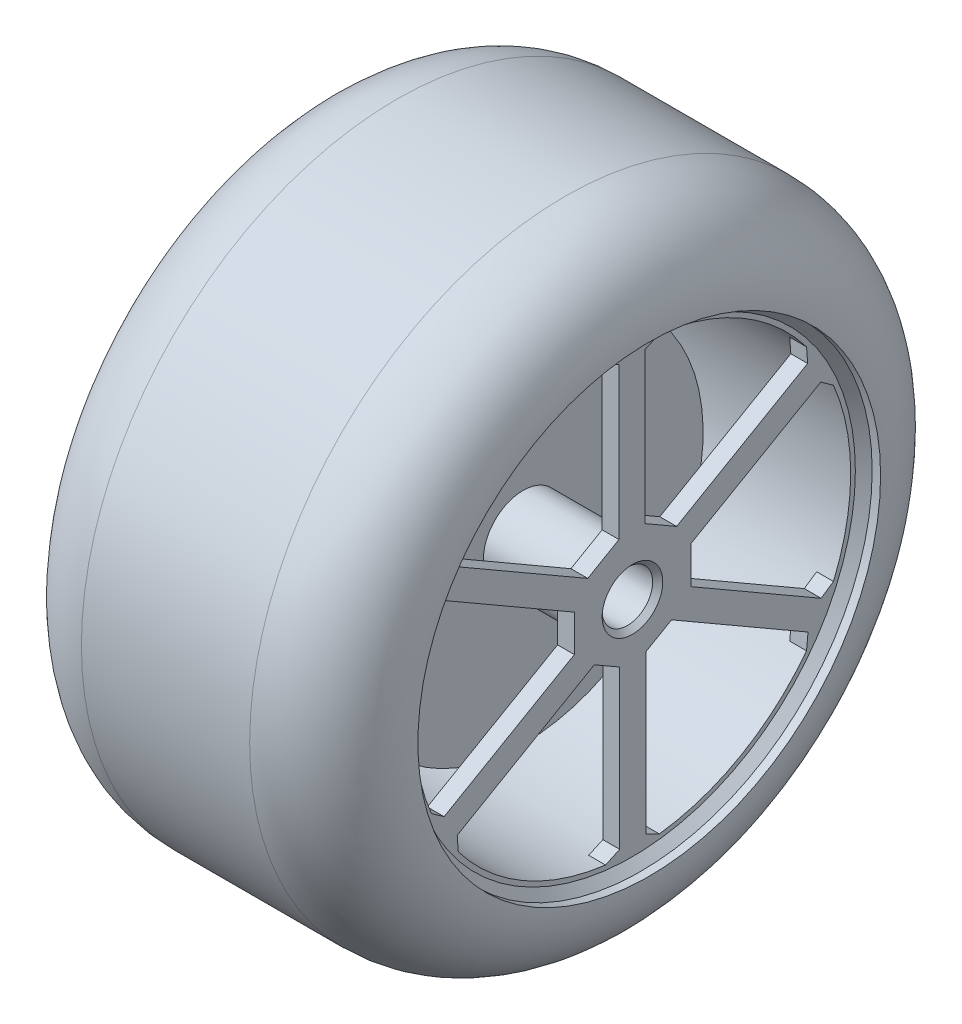
from build123d import *

# Parameters (mm, degrees)
SKETCH1_R            = 18.75
SKETCH1_R_2          = 13.75
BOSS_EXTRUDE1_DEPTH  = 20
FILLET1_R            = 5
BOSS_EXTRUDE2_START  = -19
SKETCH2_R            = 13.75
SKETCH2_R_2          = 12.971945667
BOSS_EXTRUDE2_DEPTH  = 19
CHAMFER2_SIZE        = 0.5
BOSS_EXTRUDE3_DEPTH  = 1
CIRPATTERN1_COUNT    = 6
BOSS_EXTRUDE4_DEPTH  = 1
MIRROR1_COPY_1_DEPTH = 1
MIRROR1_COPY_2_DEPTH = 1
MIRROR1_COPY_3_DEPTH = 1
MIRROR1_COPY_4_DEPTH = 1
MIRROR1_COPY_5_DEPTH = 1
SKETCH7_R            = 10.701124637
BOSS_EXTRUDE5_DEPTH  = 2.5
SKETCH8_R            = 2.357410359
BOSS_EXTRUDE6_DEPTH  = 6
BOSS_EXTRUDE7_DEPTH  = 2
BOSS_EXTRUDE8_START  = 2.5
SKETCH10_R           = 10.701124637
BOSS_EXTRUDE8_DEPTH  = 2.5
SKETCH11_R           = 1.5
CUT_EXTRUDE1_DEPTH   = 4
CHAMFER3_SIZE        = 0.1
CHAMFER4_SIZE        = 0.3


with BuildPart() as part:
    # Sketch1 → Boss-Extrude1 (new body)
    with BuildSketch(Plane(origin=(0, 0, 0), x_dir=(0, 0, -1), z_dir=(1, 0, 0))):
        Circle(SKETCH1_R)
        Circle(SKETCH1_R_2, mode=Mode.SUBTRACT)
    extrude(amount=BOSS_EXTRUDE1_DEPTH)

    # Fillet1
    fillet1_edges = [part.edges().sort_by_distance(p)[0] for p in [
        (0, 0, 18.75),
        (20, 0, 18.75),
    ]]
    fillet(fillet1_edges, radius=FILLET1_R - 0.0001)  # a hair under: the kernel refuses the full size

    # Sketch2 → Boss-Extrude2 (add)
    with BuildSketch(Plane(origin=(19, 0, 0), x_dir=(0, 0, -1), z_dir=(1, 0, 0)).offset(BOSS_EXTRUDE2_START)):
        Circle(SKETCH2_R)
        Circle(SKETCH2_R_2, mode=Mode.SUBTRACT)
    extrude(amount=BOSS_EXTRUDE2_DEPTH)

    # Chamfer2
    chamfer2_edges = [part.edges().sort_by_distance(p)[0] for p in [
        (19, 0, 13.75),
    ]]
    chamfer(chamfer2_edges, length=CHAMFER2_SIZE)

    # Sketch3 → Boss-Extrude3 (add)
    with BuildSketch(Plane(origin=(19, 0, 0), x_dir=(0, 0, -1), z_dir=(1, 0, 0))):
        with BuildLine():
            Line((-0.8, 12.486766378), (-0.8, 2.563983472))
            Line((-0.8, 2.563983472), (0.75747377, 2.563983472))
            Line((0.75747377, 2.563983472), (0.75747377, 12.486766378))
            Line((0.75747377, 12.486766378), (1.6, 12.872893008))
            ThreePointArc((1.6, 12.872893008), (0, 13.015852021), (-1.6, 12.872893008))
            Line((-1.6, 12.872893008), (-0.8, 12.486766378))
        make_face()
    boss_extrude3 = extrude(amount=-BOSS_EXTRUDE3_DEPTH)

    # CirPattern1: Boss-Extrude3 ×6 about axis
    cirpattern1_axis = Axis((0, 0, 0), (1, 0, 0))
    for i in range(1, CIRPATTERN1_COUNT):
        add(boss_extrude3.rotate(cirpattern1_axis, i * 360 / CIRPATTERN1_COUNT))

    # Sketch4 → Boss-Extrude4 (add)
    with BuildSketch(Plane(origin=(19, 0, 0), x_dir=(0, 0, -1), z_dir=(1, 0, 0))):
        Polygon((-3.45, 1.95), (0.014101615, 3.95), (3.47820323, 1.95), (3.47820323, -1.55), (0.014101615, -3.55), (-3.45, -1.55), align=None)
    boss_extrude4 = extrude(amount=-BOSS_EXTRUDE4_DEPTH)

    # Mirror1: Boss-Extrude3, Boss-Extrude4 across plane
    add(boss_extrude3.mirror(Plane(origin=(10, 0, 0), x_dir=(0, 0, 1), z_dir=(1, 0, 0))))
    add(boss_extrude4.mirror(Plane(origin=(10, 0, 0), x_dir=(0, 0, 1), z_dir=(1, 0, 0))))

    # Mirror1 copy 1 sketch → Mirror1 copy 1 (add)
    with BuildSketch(Plane(origin=(1, 0, 0), x_dir=(0, 0.8660254037844386, -0.5000000000000001), z_dir=(-1, 0, 0))):
        with BuildLine():
            Line((-0.8, -12.486766378), (-0.8, -2.563983472))
            Line((-0.8, -2.563983472), (0.75747377, -2.563983472))
            Line((0.75747377, -2.563983472), (0.75747377, -12.486766378))
            Line((0.75747377, -12.486766378), (1.6, -12.872893008))
            ThreePointArc((1.6, -12.872893008), (0, -13.015852021), (-1.6, -12.872893008))
            Line((-1.6, -12.872893008), (-0.8, -12.486766378))
        make_face()
    extrude(amount=-MIRROR1_COPY_1_DEPTH)

    # Mirror1 copy 2 sketch → Mirror1 copy 2 (add)
    with BuildSketch(Plane(origin=(1, 0, 0), x_dir=(0, 0.8660254037844387, 0.4999999999999998), z_dir=(-1, 0, 0))):
        with BuildLine():
            Line((-0.8, -12.486766378), (-0.8, -2.563983472))
            Line((-0.8, -2.563983472), (0.75747377, -2.563983472))
            Line((0.75747377, -2.563983472), (0.75747377, -12.486766378))
            Line((0.75747377, -12.486766378), (1.6, -12.872893008))
            ThreePointArc((1.6, -12.872893008), (0, -13.015852021), (-1.6, -12.872893008))
            Line((-1.6, -12.872893008), (-0.8, -12.486766378))
        make_face()
    extrude(amount=-MIRROR1_COPY_2_DEPTH)

    # Mirror1 copy 3 sketch → Mirror1 copy 3 (add)
    with BuildSketch(Plane.ZY.offset(-1)):
        with BuildLine():
            Line((-0.8, -12.486766378), (-0.8, -2.563983472))
            Line((-0.8, -2.563983472), (0.75747377, -2.563983472))
            Line((0.75747377, -2.563983472), (0.75747377, -12.486766378))
            Line((0.75747377, -12.486766378), (1.6, -12.872893008))
            ThreePointArc((1.6, -12.872893008), (0, -13.015852021), (-1.6, -12.872893008))
            Line((-1.6, -12.872893008), (-0.8, -12.486766378))
        make_face()
    extrude(amount=-MIRROR1_COPY_3_DEPTH)

    # Mirror1 copy 4 sketch → Mirror1 copy 4 (add)
    with BuildSketch(Plane(origin=(1, 0, 0), x_dir=(0, -0.8660254037844384, 0.5000000000000004), z_dir=(-1, 0, 0))):
        with BuildLine():
            Line((-0.8, -12.486766378), (-0.8, -2.563983472))
            Line((-0.8, -2.563983472), (0.75747377, -2.563983472))
            Line((0.75747377, -2.563983472), (0.75747377, -12.486766378))
            Line((0.75747377, -12.486766378), (1.6, -12.872893008))
            ThreePointArc((1.6, -12.872893008), (0, -13.015852021), (-1.6, -12.872893008))
            Line((-1.6, -12.872893008), (-0.8, -12.486766378))
        make_face()
    extrude(amount=-MIRROR1_COPY_4_DEPTH)

    # Mirror1 copy 5 sketch → Mirror1 copy 5 (add)
    with BuildSketch(Plane(origin=(1, 0, 0), x_dir=(0, -0.8660254037844386, -0.5000000000000001), z_dir=(-1, 0, 0))):
        with BuildLine():
            Line((-0.8, -12.486766378), (-0.8, -2.563983472))
            Line((-0.8, -2.563983472), (0.75747377, -2.563983472))
            Line((0.75747377, -2.563983472), (0.75747377, -12.486766378))
            Line((0.75747377, -12.486766378), (1.6, -12.872893008))
            ThreePointArc((1.6, -12.872893008), (0, -13.015852021), (-1.6, -12.872893008))
            Line((-1.6, -12.872893008), (-0.8, -12.486766378))
        make_face()
    extrude(amount=-MIRROR1_COPY_5_DEPTH)



with BuildPart() as body_2:
    # Sketch7 → Boss-Extrude5 (new body)
    with BuildSketch(Plane(origin=(10, 0, 0), x_dir=(0, 0, -1), z_dir=(1, 0, 0))):
        Circle(SKETCH7_R)
    extrude(amount=BOSS_EXTRUDE5_DEPTH)


with BuildPart() as part_1:
    add(part.part)

    add(body_2.part)  # Boss-Extrude6 merges body 2
    # Sketch8 → Boss-Extrude6 (add)
    with BuildSketch(Plane(origin=(12.5, 0, 0), x_dir=(0, 0, -1), z_dir=(1, 0, 0))):
        with Locations(Location((0, 0, 0), (0, 0, 180))):
            Circle(SKETCH8_R)
    boss_extrude6 = extrude(amount=BOSS_EXTRUDE6_DEPTH)

    # Sketch9 → Boss-Extrude7 (add)
    with BuildSketch(Plane(origin=(12.5, 0, 0), x_dir=(0, 0, -1), z_dir=(1, 0, 0))):
        with BuildLine():
            add(Edge.make_bspline(
                [(-7.390821278, 9.666270444), (-8.371055325, 9.063049492), (-10.901942554, 2.545860214), (-12.95470613, -0.678436746), (-9.56470268, -3.839663718), (-9.424408975, 2.626545893), (-2.122117509, 8.945044479), (-3.944075602, 9.735009078), (-6.353209171, 9.750739929), (-7.271794687, 9.739517577), (-7.390821278, 9.666270444)],
                knots=[0, 0, 0, 0, 0.161931321, 0.192354061, 0.291797031, 0.354141876, 0.753457658, 0.823034918, 0.980337213, 1, 1, 1, 1], degree=3))
        make_face()
    boss_extrude7 = extrude(amount=BOSS_EXTRUDE7_DEPTH)

    # Mirror4: Boss-Extrude6 across plane
    add(boss_extrude6.mirror(Plane(origin=(10, 0, 0), x_dir=(0, 0, 1), z_dir=(1, 0, 0))))

    # Sketch10 → Boss-Extrude8 (add)
    with BuildSketch(Plane.ZY.offset(-10).offset(BOSS_EXTRUDE8_START)):
        Circle(SKETCH10_R)
    extrude(amount=-BOSS_EXTRUDE8_DEPTH)

    # Mirror6: Boss-Extrude7 across plane
    add(boss_extrude7.mirror(Plane(origin=(10, 0, 0), x_dir=(0, 0, 1), z_dir=(1, 0, 0))))

    # Sketch11 → Cut-Extrude1 (cut)
    with BuildSketch(Plane(origin=(19, 0, 0), x_dir=(0, 0, -1), z_dir=(1, 0, 0))):
        Circle(SKETCH11_R)
    extrude(amount=-CUT_EXTRUDE1_DEPTH, mode=Mode.SUBTRACT)

    # Chamfer3
    chamfer3_edges = [part_1.edges().sort_by_distance(p)[0] for p in [
        (15, 0, 1.5),
    ]]
    chamfer(chamfer3_edges, length=CHAMFER3_SIZE)

    # Chamfer4
    chamfer4_edges = [part_1.edges().sort_by_distance(p)[0] for p in [
        (19, 0, 1.5),
    ]]
    chamfer(chamfer4_edges, length=CHAMFER4_SIZE)


solid = part_1.part
